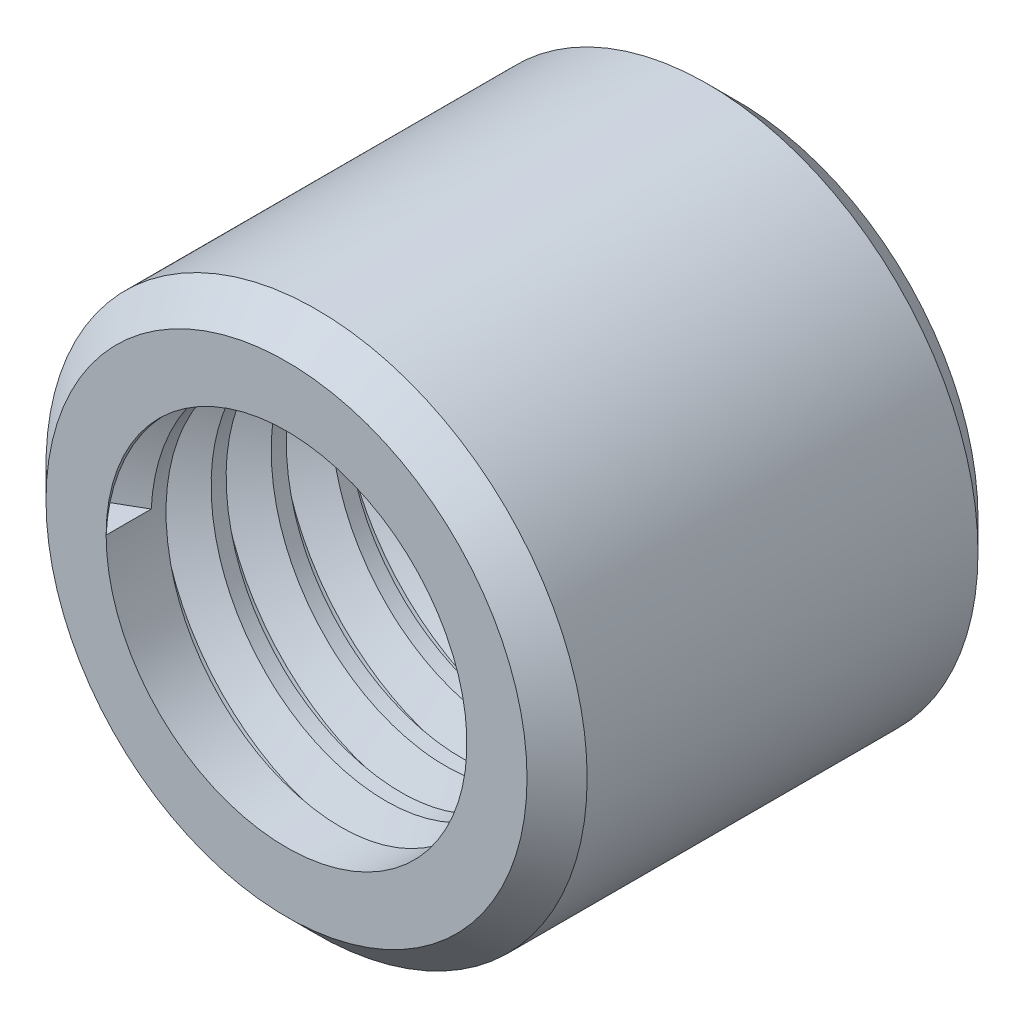
from build123d import *

# Parameters (mm, degrees)
ESQUISSE1_R        = 9
ESQUISSE1_R_2      = 6
BOSS_EXTRU_1_DEPTH = 15
FILETAGE1_PITCH    = 2
CHANFREIN1_SIZE    = 1


with BuildPart() as part:
    # Esquisse1 → Boss.-Extru.1 (new body)
    with BuildSketch(Plane.XY):
        Circle(ESQUISSE1_R)
        Circle(ESQUISSE1_R_2, mode=Mode.SUBTRACT)
    extrude(amount=BOSS_EXTRU_1_DEPTH)

    # Filetage1: the profile of Profil de filetage1 profile screwed along a right-hand helix of 7.5 turns, 10 arcs to a turn; built about Z, then put on its axis
    filetage1_z = Axis((0, 0, 0), (0, 0, 1))
    filetage1_corners = [(5.9997, 0, -0.000173205), (7.08253175, 0, 0.624999997), (7.08253175, 0, 0.874999997), (5.9997, 0, 1.5001732)]
    with BuildLine(mode=Mode.PRIVATE) as filetage1_profile:
        Line(filetage1_corners[0], filetage1_corners[1])
        Line(filetage1_corners[1], filetage1_corners[2])
        Line(filetage1_corners[2], filetage1_corners[3])
        Line(filetage1_corners[3], filetage1_corners[0])
    filetage1_cap = Face(filetage1_profile.wire())
    filetage1_turn_angles = [0, 18, 36, 54, 72, 90, 108, 126, 144, 162, 180, 198, 216, 234, 252, 270, 288, 306, 324, 342, 360]
    filetage1_turn_weights = [1, 0.9510565162951535, 1, 0.9510565162951535, 1, 0.9510565162951535, 1, 0.9510565162951535, 1, 0.9510565162951535, 1, 0.9510565162951535, 1, 0.9510565162951535, 1, 0.9510565162951535, 1, 0.9510565162951535, 1, 0.9510565162951535, 1]
    filetage1_turn_rails = [Edge.make_bspline([Vector(p[0], p[1], 0).rotate(filetage1_z, filetage1_turn_angles[k]) / filetage1_turn_weights[k] + Vector(0, 0, p[2] + FILETAGE1_PITCH * filetage1_turn_angles[k] / 360) for k in range(21)], [0, 0, 0, 1, 1, 2, 2, 3, 3, 4, 4, 5, 5, 6, 6, 7, 7, 8, 8, 9, 9, 10, 10, 10], 2, filetage1_turn_weights) for p in filetage1_corners]
    filetage1_turn_sides = [Face.make_surface_from_curves(filetage1_turn_rails[p[0]], filetage1_turn_rails[p[1]]) for p in [(0, 1), (1, 2), (2, 3), (3, 0)]]
    filetage1_last_angles = [2520, 2538, 2556, 2574, 2592, 2610, 2628, 2646, 2664, 2682, 2700]
    filetage1_last_weights = [1, 0.9510565162951535, 1, 0.9510565162951535, 1, 0.9510565162951535, 1, 0.9510565162951535, 1, 0.9510565162951535, 1]
    filetage1_last_rails = [Edge.make_bspline([Vector(p[0], p[1], 0).rotate(filetage1_z, filetage1_last_angles[k]) / filetage1_last_weights[k] + Vector(0, 0, p[2] + FILETAGE1_PITCH * filetage1_last_angles[k] / 360) for k in range(11)], [0, 0, 0, 1, 1, 2, 2, 3, 3, 4, 4, 5, 5, 5], 2, filetage1_last_weights) for p in filetage1_corners]
    filetage1_last_sides = [Face.make_surface_from_curves(filetage1_last_rails[p[0]], filetage1_last_rails[p[1]]) for p in [(0, 1), (1, 2), (2, 3), (3, 0)]]
    filetage1 = Plane(origin=(0, 0, 15), x_dir=(-1, 0, 0), z_dir=(0, 0, -1)) * Solid(Shell([*[p.moved(Location((0, 0, FILETAGE1_PITCH * i))) for i in range(7) for p in filetage1_turn_sides], *filetage1_last_sides, filetage1_cap, filetage1_cap.rotate(filetage1_z, 2700).moved(Location((0, 0, FILETAGE1_PITCH * 2700 / 360)))]))
    add(filetage1, mode=Mode.SUBTRACT)

    # Chanfrein1
    chanfrein1_edges = [part.edges().sort_by_distance(p)[0] for p in [
        (-9, 0, 0),
        (-9, 0, 15),
    ]]
    chamfer(chanfrein1_edges, length=CHANFREIN1_SIZE)


solid = part.part
